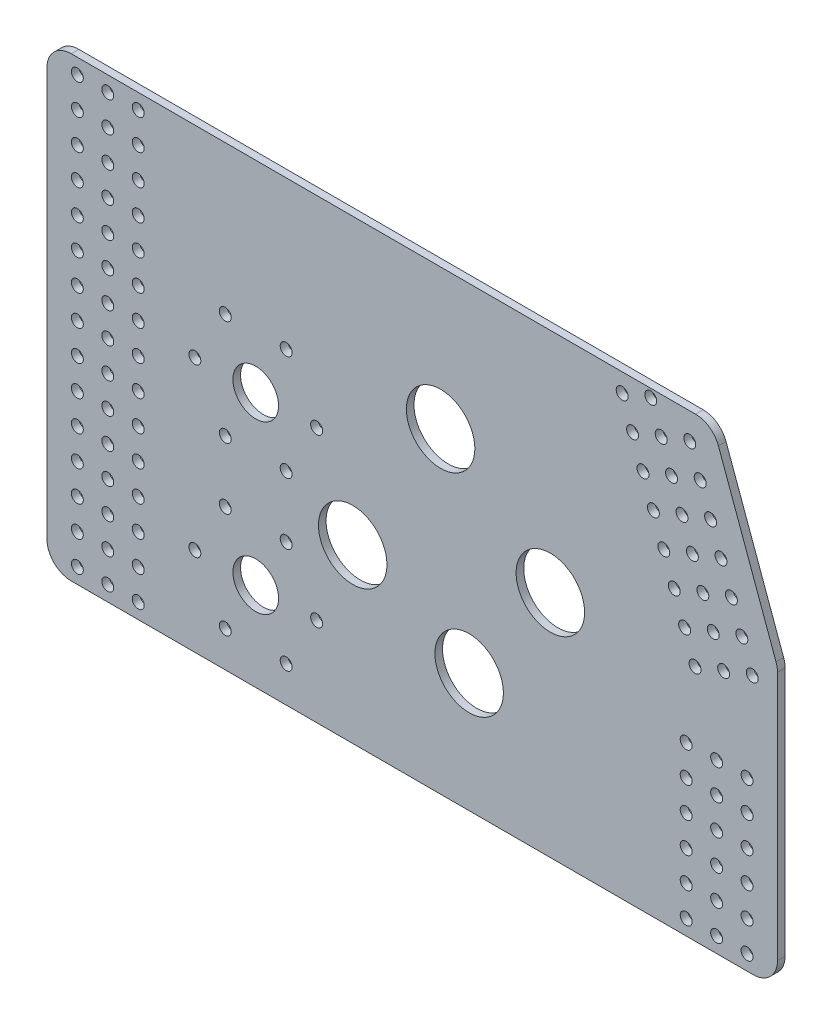
from build123d import *

# Parameters (mm, degrees)
SKETCH1_R           = 2.4892
SKETCH1_R_2         = 14.2875
SKETCH1_R_3         = 9.525
BOSS_EXTRUDE1_DEPTH = 3.175
BOSS_EXTRUDE2_START = -3.175
SKETCH2_R           = 2.4892
BOSS_EXTRUDE2_DEPTH = 3.175
FILLET1_R           = 10.16
CUT_EXTRUDE1_START  = -3.175
SKETCH3_R           = 9.525
SKETCH3_R_2         = 2.4892
CUT_EXTRUDE1_DEPTH  = 3.175
BOSS_EXTRUDE3_START = -3.175
SKETCH4_R           = 2.4892
BOSS_EXTRUDE3_DEPTH = 3.175


with BuildPart() as part:
    # Sketch1 → Boss-Extrude1 (new body)
    with BuildSketch(Plane.XY):
        Polygon((-152.4, 0), (152.4, 0), (152.4, 116.084254136), (125.314883545, 190.5), (-152.4, 190.5), align=None)
        with Locations((-139.7, 184.15)):
            Circle(SKETCH1_R, mode=Mode.SUBTRACT)
        with Locations((-127, 184.15)):
            Circle(SKETCH1_R, mode=Mode.SUBTRACT)
        with Locations((-114.3, 184.15)):
            Circle(SKETCH1_R, mode=Mode.SUBTRACT)
        with Locations((-127, 171.45)):
            Circle(SKETCH1_R, mode=Mode.SUBTRACT)
        with Locations((-114.3, 171.45)):
            Circle(SKETCH1_R, mode=Mode.SUBTRACT)
        with Locations((-127, 158.75)):
            Circle(SKETCH1_R, mode=Mode.SUBTRACT)
        with Locations((-114.3, 158.75)):
            Circle(SKETCH1_R, mode=Mode.SUBTRACT)
        with Locations((-127, 146.05)):
            Circle(SKETCH1_R, mode=Mode.SUBTRACT)
        with Locations((-114.3, 146.05)):
            Circle(SKETCH1_R, mode=Mode.SUBTRACT)
        with Locations((-127, 133.35)):
            Circle(SKETCH1_R, mode=Mode.SUBTRACT)
        with Locations((-114.3, 133.35)):
            Circle(SKETCH1_R, mode=Mode.SUBTRACT)
        with Locations((-127, 120.65)):
            Circle(SKETCH1_R, mode=Mode.SUBTRACT)
        with Locations((-114.3, 120.65)):
            Circle(SKETCH1_R, mode=Mode.SUBTRACT)
        with Locations((-127, 107.95)):
            Circle(SKETCH1_R, mode=Mode.SUBTRACT)
        with Locations((-114.3, 107.95)):
            Circle(SKETCH1_R, mode=Mode.SUBTRACT)
        with Locations((-127, 95.25)):
            Circle(SKETCH1_R, mode=Mode.SUBTRACT)
        with Locations((-114.3, 95.25)):
            Circle(SKETCH1_R, mode=Mode.SUBTRACT)
        with Locations((-127, 82.55)):
            Circle(SKETCH1_R, mode=Mode.SUBTRACT)
        with Locations((-114.3, 82.55)):
            Circle(SKETCH1_R, mode=Mode.SUBTRACT)
        with Locations((-127, 69.85)):
            Circle(SKETCH1_R, mode=Mode.SUBTRACT)
        with Locations((-114.3, 69.85)):
            Circle(SKETCH1_R, mode=Mode.SUBTRACT)
        with Locations((-127, 57.15)):
            Circle(SKETCH1_R, mode=Mode.SUBTRACT)
        with Locations((-114.3, 57.15)):
            Circle(SKETCH1_R, mode=Mode.SUBTRACT)
        with Locations((-127, 44.45)):
            Circle(SKETCH1_R, mode=Mode.SUBTRACT)
        with Locations((-114.3, 44.45)):
            Circle(SKETCH1_R, mode=Mode.SUBTRACT)
        with Locations((-127, 31.75)):
            Circle(SKETCH1_R, mode=Mode.SUBTRACT)
        with Locations((-114.3, 31.75)):
            Circle(SKETCH1_R, mode=Mode.SUBTRACT)
        with Locations((-127, 19.05)):
            Circle(SKETCH1_R, mode=Mode.SUBTRACT)
        with Locations((-114.3, 19.05)):
            Circle(SKETCH1_R, mode=Mode.SUBTRACT)
        with Locations((-127, 6.35)):
            Circle(SKETCH1_R, mode=Mode.SUBTRACT)
        with Locations((-114.3, 6.35)):
            Circle(SKETCH1_R, mode=Mode.SUBTRACT)
        with Locations((-139.7, 171.45)):
            Circle(SKETCH1_R, mode=Mode.SUBTRACT)
        with Locations((-139.7, 158.75)):
            Circle(SKETCH1_R, mode=Mode.SUBTRACT)
        with Locations((-139.7, 146.05)):
            Circle(SKETCH1_R, mode=Mode.SUBTRACT)
        with Locations((-139.7, 133.35)):
            Circle(SKETCH1_R, mode=Mode.SUBTRACT)
        with Locations((-139.7, 120.65)):
            Circle(SKETCH1_R, mode=Mode.SUBTRACT)
        with Locations((-139.7, 107.95)):
            Circle(SKETCH1_R, mode=Mode.SUBTRACT)
        with Locations((-139.7, 95.25)):
            Circle(SKETCH1_R, mode=Mode.SUBTRACT)
        with Locations((-139.7, 82.55)):
            Circle(SKETCH1_R, mode=Mode.SUBTRACT)
        with Locations((-139.7, 69.85)):
            Circle(SKETCH1_R, mode=Mode.SUBTRACT)
        with Locations((-139.7, 57.15)):
            Circle(SKETCH1_R, mode=Mode.SUBTRACT)
        with Locations((-139.7, 44.45)):
            Circle(SKETCH1_R, mode=Mode.SUBTRACT)
        with Locations((-139.7, 31.75)):
            Circle(SKETCH1_R, mode=Mode.SUBTRACT)
        with Locations((-139.7, 19.05)):
            Circle(SKETCH1_R, mode=Mode.SUBTRACT)
        with Locations((-139.7, 6.35)):
            Circle(SKETCH1_R, mode=Mode.SUBTRACT)
        with Locations((87.590706137, 182.74937795)):
            Circle(SKETCH1_R, mode=Mode.SUBTRACT)
        with Locations((99.524802421, 187.09303377)):
            Circle(SKETCH1_R, mode=Mode.SUBTRACT)
        with Locations((115.802554525, 179.502593307)):
            Circle(SKETCH1_R, mode=Mode.SUBTRACT)
        with Locations((91.934361957, 170.815281666)):
            Circle(SKETCH1_R, mode=Mode.SUBTRACT)
        with Locations((103.868458241, 175.158937486)):
            Circle(SKETCH1_R, mode=Mode.SUBTRACT)
        with Locations((120.146210345, 167.568497023)):
            Circle(SKETCH1_R, mode=Mode.SUBTRACT)
        with Locations((96.278017777, 158.881185382)):
            Circle(SKETCH1_R, mode=Mode.SUBTRACT)
        with Locations((108.212114061, 163.224841202)):
            Circle(SKETCH1_R, mode=Mode.SUBTRACT)
        with Locations((124.489866165, 155.634400739)):
            Circle(SKETCH1_R, mode=Mode.SUBTRACT)
        with Locations((100.621673597, 146.947089098)):
            Circle(SKETCH1_R, mode=Mode.SUBTRACT)
        with Locations((112.555769881, 151.290744918)):
            Circle(SKETCH1_R, mode=Mode.SUBTRACT)
        with Locations((128.833521986, 143.700304455)):
            Circle(SKETCH1_R, mode=Mode.SUBTRACT)
        with Locations((104.965329418, 135.012992814)):
            Circle(SKETCH1_R, mode=Mode.SUBTRACT)
        with Locations((116.899425702, 139.356648634)):
            Circle(SKETCH1_R, mode=Mode.SUBTRACT)
        with Locations((133.177177806, 131.766208171)):
            Circle(SKETCH1_R, mode=Mode.SUBTRACT)
        with Locations((109.308985238, 123.07889653)):
            Circle(SKETCH1_R, mode=Mode.SUBTRACT)
        with Locations((121.243081522, 127.42255235)):
            Circle(SKETCH1_R, mode=Mode.SUBTRACT)
        with Locations((137.520833626, 119.832111887)):
            Circle(SKETCH1_R, mode=Mode.SUBTRACT)
        with Locations((113.652641058, 111.144800246)):
            Circle(SKETCH1_R, mode=Mode.SUBTRACT)
        with Locations((125.586737342, 115.488456066)):
            Circle(SKETCH1_R, mode=Mode.SUBTRACT)
        with Locations((141.864489446, 107.898015603)):
            Circle(SKETCH1_R, mode=Mode.SUBTRACT)
        with Locations((117.996296878, 99.210703962)):
            Circle(SKETCH1_R, mode=Mode.SUBTRACT)
        with Locations((129.930393162, 103.554359782)):
            Circle(SKETCH1_R, mode=Mode.SUBTRACT)
        with Locations((146.208145266, 95.963919319)):
            Circle(SKETCH1_R, mode=Mode.SUBTRACT)
        with Locations((114.3, 69.85)):
            Circle(SKETCH1_R, mode=Mode.SUBTRACT)
        with Locations((127, 69.85)):
            Circle(SKETCH1_R, mode=Mode.SUBTRACT)
        with Locations((139.7, 69.85)):
            Circle(SKETCH1_R, mode=Mode.SUBTRACT)
        with Locations((114.3, 57.15)):
            Circle(SKETCH1_R, mode=Mode.SUBTRACT)
        with Locations((127, 57.15)):
            Circle(SKETCH1_R, mode=Mode.SUBTRACT)
        with Locations((139.7, 57.15)):
            Circle(SKETCH1_R, mode=Mode.SUBTRACT)
        with Locations((114.3, 44.45)):
            Circle(SKETCH1_R, mode=Mode.SUBTRACT)
        with Locations((127, 44.45)):
            Circle(SKETCH1_R, mode=Mode.SUBTRACT)
        with Locations((139.7, 44.45)):
            Circle(SKETCH1_R, mode=Mode.SUBTRACT)
        with Locations((114.3, 31.75)):
            Circle(SKETCH1_R, mode=Mode.SUBTRACT)
        with Locations((127, 31.75)):
            Circle(SKETCH1_R, mode=Mode.SUBTRACT)
        with Locations((139.7, 31.75)):
            Circle(SKETCH1_R, mode=Mode.SUBTRACT)
        with Locations((114.3, 19.05)):
            Circle(SKETCH1_R, mode=Mode.SUBTRACT)
        with Locations((127, 19.05)):
            Circle(SKETCH1_R, mode=Mode.SUBTRACT)
        with Locations((139.7, 19.05)):
            Circle(SKETCH1_R, mode=Mode.SUBTRACT)
        with Locations((114.3, 6.35)):
            Circle(SKETCH1_R, mode=Mode.SUBTRACT)
        with Locations((127, 6.35)):
            Circle(SKETCH1_R, mode=Mode.SUBTRACT)
        with Locations((139.7, 6.35)):
            Circle(SKETCH1_R, mode=Mode.SUBTRACT)
        with Locations((11.850775283, 132.016841695)):
            Circle(SKETCH1_R_2, mode=Mode.SUBTRACT)
        with Locations((-24.819733341, 71.744857423)):
            Circle(SKETCH1_R_2, mode=Mode.SUBTRACT)
        with Locations((57.635078008, 95.712451111)):
            Circle(SKETCH1_R_2, mode=Mode.SUBTRACT)
        with Locations((23.754601626, 49.678686248)):
            Circle(SKETCH1_R_2, mode=Mode.SUBTRACT)
        with Locations((-65.270180641, 36.953448556)):
            Circle(SKETCH1_R_3, mode=Mode.SUBTRACT)
        with Locations((-65.270180641, 106.549448556)):
            Circle(SKETCH1_R_3, mode=Mode.SUBTRACT)
        with Locations((-65.270180641, 131.949448556)):
            Circle(SKETCH1_R, mode=Mode.SUBTRACT)
        with Locations((-65.270180641, 11.553448556)):
            Circle(SKETCH1_R, mode=Mode.SUBTRACT)
        with Locations((-43.273135384, 119.249448556)):
            Circle(SKETCH1_R, mode=Mode.SUBTRACT)
        with Locations((-43.273135384, 93.849448556)):
            Circle(SKETCH1_R, mode=Mode.SUBTRACT)
        with Locations((-65.270180641, 81.149448556)):
            Circle(SKETCH1_R, mode=Mode.SUBTRACT)
        with Locations((-87.267225897, 93.849448556)):
            Circle(SKETCH1_R, mode=Mode.SUBTRACT)
        with Locations((-87.267225897, 119.249448556)):
            Circle(SKETCH1_R, mode=Mode.SUBTRACT)
        with Locations((-87.267225897, 24.253448556)):
            Circle(SKETCH1_R, mode=Mode.SUBTRACT)
        with Locations((-87.267225897, 49.653448556)):
            Circle(SKETCH1_R, mode=Mode.SUBTRACT)
        with Locations((-65.270180641, 62.353448556)):
            Circle(SKETCH1_R, mode=Mode.SUBTRACT)
        with Locations((-43.273135384, 49.653448556)):
            Circle(SKETCH1_R, mode=Mode.SUBTRACT)
        with Locations((-43.273135384, 24.253448556)):
            Circle(SKETCH1_R, mode=Mode.SUBTRACT)
    extrude(amount=BOSS_EXTRUDE1_DEPTH)

    # Sketch2 → Boss-Extrude2 (add)
    with BuildSketch(Plane.XY.offset(3.175).offset(BOSS_EXTRUDE2_START)):
        with Locations((146.208145266, 95.963919319)):
            Circle(SKETCH2_R)
    extrude(amount=BOSS_EXTRUDE2_DEPTH)

    # Fillet1
    fillet1_edges = [part.edges().sort_by_distance(p)[0] for p in [
        (-152.4, 0, 1.5875),
        (152.4, 0, 1.5875),
        (152.4, 116.084254136, 1.5875),
        (125.314883545, 190.5, 1.5875),
        (-152.4, 190.5, 1.5875),
    ]]
    fillet(fillet1_edges, radius=FILLET1_R)

    # Sketch3 → Cut-Extrude1 (cut)
    with BuildSketch(Plane.XY.offset(3.175).offset(CUT_EXTRUDE1_START)):
        with Locations((-65.270180641, 106.549448556)):
            Circle(SKETCH3_R)
        with Locations((-39.870180641, 106.549448556)):
            Circle(SKETCH3_R_2)
        with Locations((-52.570180641, 84.5524033)):
            Circle(SKETCH3_R_2)
        with Locations((-77.970180641, 84.5524033)):
            Circle(SKETCH3_R_2)
        with Locations((-90.670180641, 106.549448556)):
            Circle(SKETCH3_R_2)
        with Locations((-77.970180641, 128.546493812)):
            Circle(SKETCH3_R_2)
        with Locations((-52.570180641, 128.546493812)):
            Circle(SKETCH3_R_2)
        with Locations((-65.270180641, 36.953448556)):
            Circle(SKETCH3_R)
        with Locations((-39.870180641, 36.953448556)):
            Circle(SKETCH3_R_2)
        with Locations((-52.570180641, 14.9564033)):
            Circle(SKETCH3_R_2)
        with Locations((-77.970180641, 14.9564033)):
            Circle(SKETCH3_R_2)
        with Locations((-90.670180641, 36.953448556)):
            Circle(SKETCH3_R_2)
        with Locations((-77.970180641, 58.950493812)):
            Circle(SKETCH3_R_2)
        with Locations((-52.570180641, 58.950493812)):
            Circle(SKETCH3_R_2)
    extrude(amount=CUT_EXTRUDE1_DEPTH, mode=Mode.SUBTRACT)

    # Sketch4 → Boss-Extrude3 (add)
    with BuildSketch(Plane.XY.offset(3.175).offset(BOSS_EXTRUDE3_START)):
        with Locations((-65.270180641, 131.949448556)):
            Circle(SKETCH4_R)
        with Locations((-43.273135384, 119.249448556)):
            Circle(SKETCH4_R)
        with Locations((-43.273135384, 93.849448556)):
            Circle(SKETCH4_R)
        with Locations((-65.270180641, 81.149448556)):
            Circle(SKETCH4_R)
        with Locations((-87.267225897, 93.849448556)):
            Circle(SKETCH4_R)
        with Locations((-87.267225897, 119.249448556)):
            Circle(SKETCH4_R)
        with Locations((-65.270180641, 62.353448556)):
            Circle(SKETCH4_R)
        with Locations((-43.273135384, 49.653448556)):
            Circle(SKETCH4_R)
        with Locations((-43.273135384, 24.253448556)):
            Circle(SKETCH4_R)
        with Locations((-65.270180641, 11.553448556)):
            Circle(SKETCH4_R)
        with Locations((-87.267225897, 24.253448556)):
            Circle(SKETCH4_R)
        with Locations((-87.267225897, 49.653448556)):
            Circle(SKETCH4_R)
    extrude(amount=BOSS_EXTRUDE3_DEPTH)


solid = part.part
